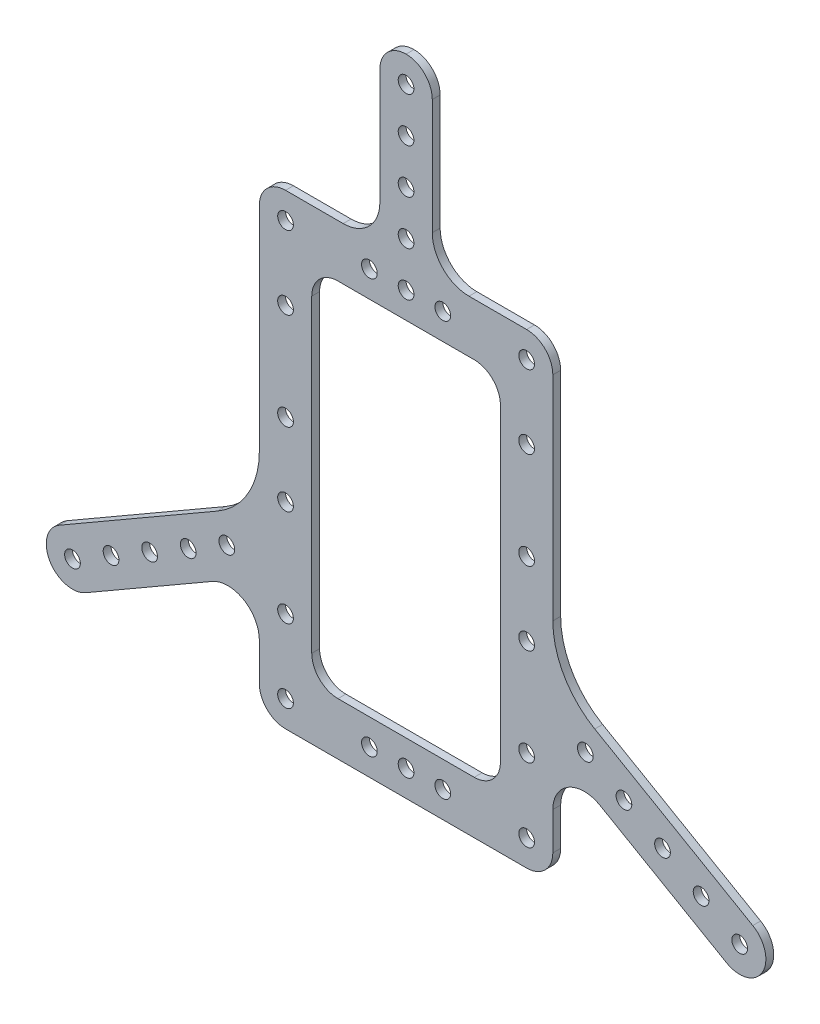
from build123d import *

# Parameters (mm, degrees)
SKETCH_1_R      = 1.5
SKETCH_1_W      = 36
SKETCH_1_H      = 69
EXTRUDE_1_DEPTH = 1.5
FILLET_1_R      = 5
FILLET_2_R      = 6
FILLET_3_R      = 16
FILLET_4_R      = 7
FILLET_5_R      = 5


with BuildPart() as part:
    # 草图1 → 凸台-拉伸1 (new body)
    with BuildSketch(Plane.XY):
        Polygon((28, 44.5), (5, 44.5), (5, 78.5), (-5, 78.5), (-5, 44.5), (-28, 44.5), (-28, -10.392304845), (-70.482994197, -34.919872981), (-65.482994197, -43.580127019), (-28, -21.939310229), (-28, -44.5), (28, -44.5), (28, -21.939310229), (65.482994197, -43.580127019), (70.482994197, -34.919872981), (28, -10.392304845), align=None)
        with Locations((23, -39.5)):
            Circle(SKETCH_1_R, mode=Mode.SUBTRACT)
        with Locations((-23, -39.5)):
            Circle(SKETCH_1_R, mode=Mode.SUBTRACT)
        with Locations((-23, 39.5)):
            Circle(SKETCH_1_R, mode=Mode.SUBTRACT)
        with Locations((23, 39.5)):
            Circle(SKETCH_1_R, mode=Mode.SUBTRACT)
        with Locations((-23, 25.5)):
            Circle(SKETCH_1_R, mode=Mode.SUBTRACT)
        with Locations((23, 25.5)):
            Circle(SKETCH_1_R, mode=Mode.SUBTRACT)
        with Locations((23, -25.5)):
            Circle(SKETCH_1_R, mode=Mode.SUBTRACT)
        with Locations((-23, -25.5)):
            Circle(SKETCH_1_R, mode=Mode.SUBTRACT)
        with Locations((0, 39.5)):
            Circle(SKETCH_1_R, mode=Mode.SUBTRACT)
        with Locations((0, 73.5)):
            Circle(SKETCH_1_R, mode=Mode.SUBTRACT)
        with Locations((-63.652867178, -36.75)):
            Circle(SKETCH_1_R, mode=Mode.SUBTRACT)
        with Locations((-34.208003449, -19.75)):
            Circle(SKETCH_1_R, mode=Mode.SUBTRACT)
        with Locations((63.652867178, -36.75)):
            Circle(SKETCH_1_R, mode=Mode.SUBTRACT)
        with Locations((34.208003449, -19.75)):
            Circle(SKETCH_1_R, mode=Mode.SUBTRACT)
        with Locations((0, -39.5)):
            Circle(SKETCH_1_R, mode=Mode.SUBTRACT)
        with Locations((7, -39.5)):
            Circle(SKETCH_1_R, mode=Mode.SUBTRACT)
        with Locations((-7, -39.5)):
            Circle(SKETCH_1_R, mode=Mode.SUBTRACT)
        with Locations((7, 39.5)):
            Circle(SKETCH_1_R, mode=Mode.SUBTRACT)
        with Locations((-7, 39.5)):
            Circle(SKETCH_1_R, mode=Mode.SUBTRACT)
        with Locations((-23, 7)):
            Circle(SKETCH_1_R, mode=Mode.SUBTRACT)
        with Locations((-23, -7)):
            Circle(SKETCH_1_R, mode=Mode.SUBTRACT)
        with Locations((23, 7)):
            Circle(SKETCH_1_R, mode=Mode.SUBTRACT)
        with Locations((23, -7)):
            Circle(SKETCH_1_R, mode=Mode.SUBTRACT)
        with Locations((0, 65)):
            Circle(SKETCH_1_R, mode=Mode.SUBTRACT)
        with Locations((0, 56.5)):
            Circle(SKETCH_1_R, mode=Mode.SUBTRACT)
        with Locations((0, 48)):
            Circle(SKETCH_1_R, mode=Mode.SUBTRACT)
        with Locations((56.291651246, -32.5)):
            Circle(SKETCH_1_R, mode=Mode.SUBTRACT)
        with Locations((48.930435314, -28.25)):
            Circle(SKETCH_1_R, mode=Mode.SUBTRACT)
        with Locations((41.569219382, -24)):
            Circle(SKETCH_1_R, mode=Mode.SUBTRACT)
        with Locations((-56.291651246, -32.5)):
            Circle(SKETCH_1_R, mode=Mode.SUBTRACT)
        with Locations((-48.930435314, -28.25)):
            Circle(SKETCH_1_R, mode=Mode.SUBTRACT)
        with Locations((-41.569219382, -24)):
            Circle(SKETCH_1_R, mode=Mode.SUBTRACT)
        Rectangle(SKETCH_1_W, SKETCH_1_H, mode=Mode.SUBTRACT)
    extrude(amount=EXTRUDE_1_DEPTH)

    # 圆角1
    fillet_1_edges = [part.edges().sort_by_distance(p)[0] for p in [
        (28, 44.5, 0.75),
        (28, -44.5, 0.75),
        (-28, -44.5, 0.75),
        (-28, 44.5, 0.75),
        (-18, 34.5, 0.75),
        (-18, -34.5, 0.75),
        (18, -34.5, 0.75),
        (18, 34.5, 0.75),
    ]]
    fillet(fillet_1_edges, radius=FILLET_1_R)

    # 圆角2
    fillet_2_edges = [part.edges().sort_by_distance(p)[0] for p in [
        (28, -21.939310229, 0.75),
        (-28, -21.939310229, 0.75),
    ]]
    fillet(fillet_2_edges, radius=FILLET_2_R)

    # 圆角3
    fillet_3_edges = [part.edges().sort_by_distance(p)[0] for p in [
        (28, -10.392304845, 0.75),
        (-28, -10.392304845, 0.75),
    ]]
    fillet(fillet_3_edges, radius=FILLET_3_R)

    # 圆角4
    fillet_4_edges = [part.edges().sort_by_distance(p)[0] for p in [
        (-5, 44.5, 0.75),
        (5, 44.5, 0.75),
    ]]
    fillet(fillet_4_edges, radius=FILLET_4_R)

    # 圆角5
    fillet_5_edges = [part.edges().sort_by_distance(p)[0] for p in [
        (5, 78.5, 0.75),
        (-5, 78.5, 0.75),
        (65.482994197, -43.580127019, 0.75),
        (70.482994197, -34.919872981, 0.75),
        (-65.482994197, -43.580127019, 0.75),
        (-70.482994197, -34.919872981, 0.75),
    ]]
    fillet(fillet_5_edges, radius=FILLET_5_R - 0.0001)  # a hair under: the kernel refuses the full size


solid = part.part
